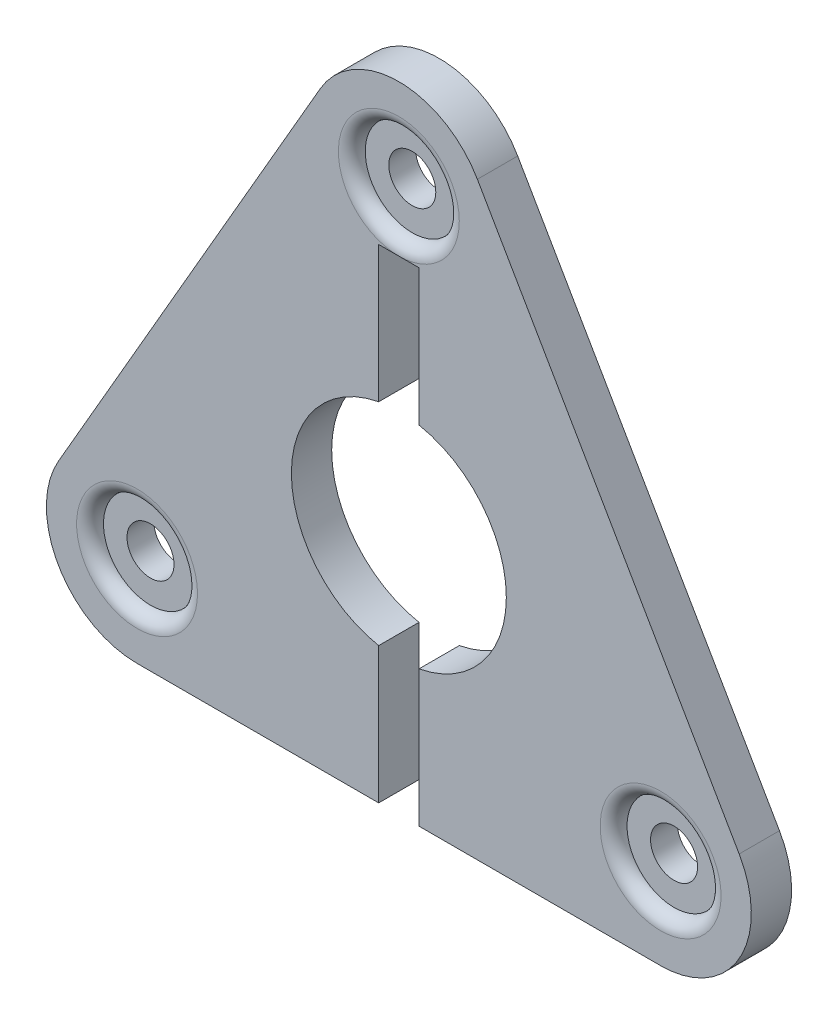
from build123d import *

# Parameters (mm, degrees)
SKETCH1_R           = 1.75
BOSS_EXTRUDE1_DEPTH = 3
SKETCH2_R           = 3.5
CUT_EXTRUDE1_DEPTH  = 1
FILLET1_R           = 1


with BuildPart() as part:
    # Sketch1 → Boss-Extrude1 (new body)
    with BuildSketch(Plane.XY):
        with BuildLine():
            Line((-5.845671476, 25.875), (-25.331243061, -7.875))
            ThreePointArc((-25.331243061, -7.875), (-25.331243061, -14.625), (-19.485571585, -18))
            Line((-19.485571585, -18), (-1.5, -18))
            Line((-1.5, -18), (-1.5, -7.858116823))
            ThreePointArc((-1.5, -7.858116823), (-8, 0), (-1.5, 7.858116823))
            Line((-1.5, 7.858116823), (-1.5, 18))
            Line((-1.5, 18), (1.5, 18))
            Line((1.5, 18), (1.5, 7.858116823))
            ThreePointArc((1.5, 7.858116823), (6.164414003, 5.099019514), (8, 0))
            ThreePointArc((8, 0), (6.164414003, -5.099019514), (1.5, -7.858116823))
            Line((1.5, -7.858116823), (1.5, -18))
            Line((1.5, -18), (19.485571585, -18))
            ThreePointArc((19.485571585, -18), (25.331243061, -14.625), (25.331243061, -7.875))
            Line((25.331243061, -7.875), (5.845671476, 25.875))
            ThreePointArc((5.845671476, 25.875), (0, 29.25), (-5.845671476, 25.875))
        make_face()
        with Locations((-19.485571585, -11.25)):
            Circle(SKETCH1_R, mode=Mode.SUBTRACT)
        with Locations((19.485571585, -11.25)):
            Circle(SKETCH1_R, mode=Mode.SUBTRACT)
        with Locations((0, 22.5)):
            Circle(SKETCH1_R, mode=Mode.SUBTRACT)
    extrude(amount=BOSS_EXTRUDE1_DEPTH)

    # Sketch2 → Cut-Extrude1 (cut)
    with BuildSketch(Plane.XY.offset(3)):
        with Locations((0, 22.5)):
            Circle(SKETCH2_R)
        with Locations((19.485571585, -11.25)):
            Circle(SKETCH2_R)
        with Locations((-19.485571585, -11.25)):
            Circle(SKETCH2_R)
    extrude(amount=-CUT_EXTRUDE1_DEPTH, mode=Mode.SUBTRACT)

    # Fillet1
    fillet1_edges = [part.edges().sort_by_distance(p)[0] for p in [
        (-3.5, 22.5, 3),
        (15.985571585, -11.25, 3),
        (-22.985571585, -11.25, 3),
    ]]
    fillet(fillet1_edges, radius=FILLET1_R - 0.0001)  # a hair under: the kernel refuses the full size


solid = part.part
